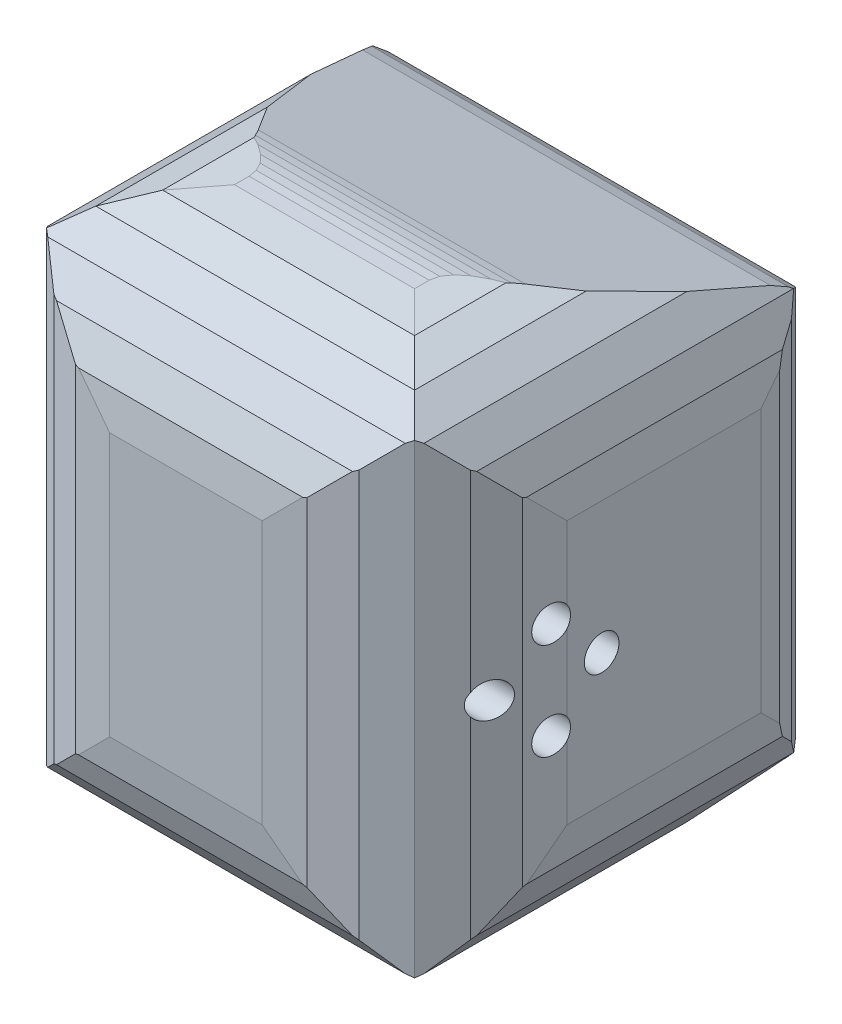
from build123d import *

# Parameters (mm, degrees)
BOSS_1_DEPTH    = 66
CUT_2_DEPTH     = 80
CUT_3_DEPTH     = 80
CUT_4_DEPTH     = 80
CUT_5_DEPTH     = 80
CUT_6_DEPTH     = 62.2
CUT_7_DEPTH     = 62.2
CUT_8_DEPTH     = 62.2
CUT_9_DEPTH     = 62.2
S_CUT10_W       = 52
S_CUT10_H       = 48
POCKET_10_DEPTH = 12.1
S_CUT11_W       = 52
S_CUT11_H       = 60
POCKET_11_DEPTH = 36
S_CUT12_W       = 36
S_CUT12_H       = 48
POCKET_12_DEPTH = 6.1
S_CUT13_W       = 7.2
S_CUT13_H       = 32
POCKET_13_DEPTH = 28
S_HOLE14_R      = 4
HOLE_14_DEPTH   = 4.2
S_HOLE15_R      = 2.5
HOLE_15_DEPTH   = 7.2
S_HOLE16_R      = 2.5
HOLE_16_DEPTH   = 7.2
S_HOLE17_R      = 2.5
HOLE_17_DEPTH   = 7.2
S_HOLE18_R      = 2.5
HOLE_18_DEPTH   = 7.2
S_HOLE19_R      = 3
HOLE_19_DEPTH   = 4.2
S_HOLE20_R      = 1.35
HOLE_20_DEPTH   = 4.2
S_HOLE21_R      = 1.35
HOLE_21_DEPTH   = 4.2
S_HOLE22_R      = 1.35
HOLE_22_DEPTH   = 4.2
S_HOLE23_R      = 1.35
HOLE_23_DEPTH   = 4.2


with BuildPart() as part:
    # S_prism1 → Boss_1 (new body)
    with BuildSketch(Plane(origin=(-33, 0, 0), x_dir=(0, 0, -1), z_dir=(1, 0, 0))):
        Polygon((-7.078, -30.163), (-5.128, -29.332), (-3.396, -28.109), (-1.962, -26.548), (-0.889, -24.72), (-0.225, -22.707), (0, -20.599), (0, 20.599), (-0.225, 22.707), (-0.889, 24.72), (-1.962, 26.548), (-3.396, 28.109), (-5.128, 29.332), (-7.078, 30.163), (-32.286, 37.865), (-33.524, 38.21), (-34.777, 38.494), (-36.043, 38.715), (-37.318, 38.873), (-38.599, 38.968), (-39.884, 39), (-42, 39), (-47.176, 38.319), (-52, 36.321), (-56.142, 33.142), (-59.321, 29), (-61.319, 24.176), (-62, 19), (-62, -19), (-61.319, -24.176), (-59.321, -29), (-56.142, -33.142), (-52, -36.321), (-47.176, -38.319), (-42, -39), (-39.884, -39), (-38.599, -38.968), (-37.318, -38.873), (-36.043, -38.715), (-34.777, -38.494), (-33.524, -38.21), (-32.286, -37.865), align=None)
    extrude(amount=BOSS_1_DEPTH)

    # S_pcut2 → Cut_2 (cut)
    with BuildSketch(Plane(origin=(0, -40, 0), x_dir=(1, 0, 0), z_dir=(0, 1, 0))):
        Polygon((33.6, -62.6), (11, -62.6), (11, -62), (16.694, -61.25), (22, -59.053), (26.556, -55.556), (30.053, -51), (32.25, -45.694), (33, -40), (33.6, -40), align=None)
    extrude(amount=CUT_2_DEPTH, mode=Mode.SUBTRACT)

    # S_pcut3 → Cut_3 (cut)
    with BuildSketch(Plane(origin=(0, -40, 0), x_dir=(1, 0, 0), z_dir=(0, 1, 0))):
        Polygon((-33.6, -62.6), (-11, -62.6), (-11, -62), (-16.694, -61.25), (-22, -59.053), (-26.556, -55.556), (-30.053, -51), (-32.25, -45.694), (-33, -40), (-33.6, -40), align=None)
    extrude(amount=CUT_3_DEPTH, mode=Mode.SUBTRACT)

    # S_pcut4 → Cut_4 (cut)
    with BuildSketch(Plane(origin=(0, -40, 0), x_dir=(1, 0, 0), z_dir=(0, 1, 0))):
        Polygon((33.6, 0.6), (21, 0.6), (21, 0), (24.106, -0.409), (27, -1.608), (29.485, -3.515), (31.392, -6), (32.591, -8.894), (33, -12), (33.6, -12), align=None)
    extrude(amount=CUT_4_DEPTH, mode=Mode.SUBTRACT)

    # S_pcut5 → Cut_5 (cut)
    with BuildSketch(Plane(origin=(0, -40, 0), x_dir=(1, 0, 0), z_dir=(0, 1, 0))):
        Polygon((-33.6, 0.6), (-21, 0.6), (-21, 0), (-24.106, -0.409), (-27, -1.608), (-29.485, -3.515), (-31.392, -6), (-32.591, -8.894), (-33, -12), (-33.6, -12), align=None)
    extrude(amount=CUT_5_DEPTH, mode=Mode.SUBTRACT)

    # S_pcut6 → Cut_6 (cut)
    with BuildSketch(Plane.XY.offset(-0.1)):
        Polygon((33.6, 39.6), (13, 39.6), (13, 39), (18.176, 38.319), (23, 36.321), (27.142, 33.142), (30.321, 29), (32.319, 24.176), (33, 19), (33.6, 19), align=None)
    extrude(amount=CUT_6_DEPTH, mode=Mode.SUBTRACT)

    # S_pcut7 → Cut_7 (cut)
    with BuildSketch(Plane.XY.offset(-0.1)):
        Polygon((33.6, -39.6), (13, -39.6), (13, -39), (18.176, -38.319), (23, -36.321), (27.142, -33.142), (30.321, -29), (32.319, -24.176), (33, -19), (33.6, -19), align=None)
    extrude(amount=CUT_7_DEPTH, mode=Mode.SUBTRACT)

    # S_pcut8 → Cut_8 (cut)
    with BuildSketch(Plane.XY.offset(-0.1)):
        Polygon((-33.6, 39.6), (-13, 39.6), (-13, 39), (-18.176, 38.319), (-23, 36.321), (-27.142, 33.142), (-30.321, 29), (-32.319, 24.176), (-33, 19), (-33.6, 19), align=None)
    extrude(amount=CUT_8_DEPTH, mode=Mode.SUBTRACT)

    # S_pcut9 → Cut_9 (cut)
    with BuildSketch(Plane.XY.offset(-0.1)):
        Polygon((-33.6, -39.6), (-13, -39.6), (-13, -39), (-18.176, -38.319), (-23, -36.321), (-27.142, -33.142), (-30.321, -29), (-32.319, -24.176), (-33, -19), (-33.6, -19), align=None)
    extrude(amount=CUT_9_DEPTH, mode=Mode.SUBTRACT)

    # S_cut10 → Pocket_10 (cut)
    with BuildSketch(Plane.XY.offset(4)):
        Rectangle(S_CUT10_W, S_CUT10_H)
    extrude(amount=POCKET_10_DEPTH, mode=Mode.SUBTRACT)

    # S_cut11 → Pocket_11 (cut)
    with BuildSketch(Plane.XY.offset(16)):
        Rectangle(S_CUT11_W, S_CUT11_H)
    extrude(amount=POCKET_11_DEPTH, mode=Mode.SUBTRACT)

    # S_cut12 → Pocket_12 (cut)
    with BuildSketch(Plane.XY.offset(51.9)):
        Rectangle(S_CUT12_W, S_CUT12_H)
    extrude(amount=POCKET_12_DEPTH, mode=Mode.SUBTRACT)

    # S_cut13 → Pocket_13 (cut)
    with BuildSketch(Plane.XY.offset(16)):
        with Locations((-29.5, 0)):
            Rectangle(S_CUT13_W, S_CUT13_H)
    extrude(amount=POCKET_13_DEPTH, mode=Mode.SUBTRACT)

    # S_hole14 → Hole_14 (cut)
    with BuildSketch(Plane.XY.offset(-0.1)):
        with Locations((-18, 0)):
            Circle(S_HOLE14_R)
    extrude(amount=HOLE_14_DEPTH, mode=Mode.SUBTRACT)

    # S_hole15 → Hole_15 (cut)
    with BuildSketch(Plane(origin=(25.9, 0, 0), x_dir=(0, 0, -1), z_dir=(1, 0, 0))):
        with Locations((-49, 0)):
            Circle(S_HOLE15_R)
    extrude(amount=HOLE_15_DEPTH, mode=Mode.SUBTRACT)

    # S_hole16 → Hole_16 (cut)
    with BuildSketch(Plane(origin=(25.9, 0, 0), x_dir=(0, 0, -1), z_dir=(1, 0, 0))):
        with Locations((-42, 7)):
            Circle(S_HOLE16_R)
    extrude(amount=HOLE_16_DEPTH, mode=Mode.SUBTRACT)

    # S_hole17 → Hole_17 (cut)
    with BuildSketch(Plane(origin=(25.9, 0, 0), x_dir=(0, 0, -1), z_dir=(1, 0, 0))):
        with Locations((-42, -7)):
            Circle(S_HOLE17_R)
    extrude(amount=HOLE_17_DEPTH, mode=Mode.SUBTRACT)

    # S_hole18 → Hole_18 (cut)
    with BuildSketch(Plane(origin=(25.9, 0, 0), x_dir=(0, 0, -1), z_dir=(1, 0, 0))):
        with Locations((-35, 0)):
            Circle(S_HOLE18_R)
    extrude(amount=HOLE_18_DEPTH, mode=Mode.SUBTRACT)

    # S_hole19 → Hole_19 (cut)
    with BuildSketch(Plane.XY.offset(-0.1)):
        Circle(S_HOLE19_R)
    extrude(amount=HOLE_19_DEPTH, mode=Mode.SUBTRACT)

    # S_hole20 → Hole_20 (cut)
    with BuildSketch(Plane.XY.offset(-0.1)):
        with Locations((7, 0)):
            Circle(S_HOLE20_R)
    extrude(amount=HOLE_20_DEPTH, mode=Mode.SUBTRACT)

    # S_hole21 → Hole_21 (cut)
    with BuildSketch(Plane.XY.offset(-0.1)):
        with Locations((0, 7)):
            Circle(S_HOLE21_R)
    extrude(amount=HOLE_21_DEPTH, mode=Mode.SUBTRACT)

    # S_hole22 → Hole_22 (cut)
    with BuildSketch(Plane.XY.offset(-0.1)):
        with Locations((-7, 0)):
            Circle(S_HOLE22_R)
    extrude(amount=HOLE_22_DEPTH, mode=Mode.SUBTRACT)

    # S_hole23 → Hole_23 (cut)
    with BuildSketch(Plane.XY.offset(-0.1)):
        with Locations((0, -7)):
            Circle(S_HOLE23_R)
    extrude(amount=HOLE_23_DEPTH, mode=Mode.SUBTRACT)


solid = part.part
